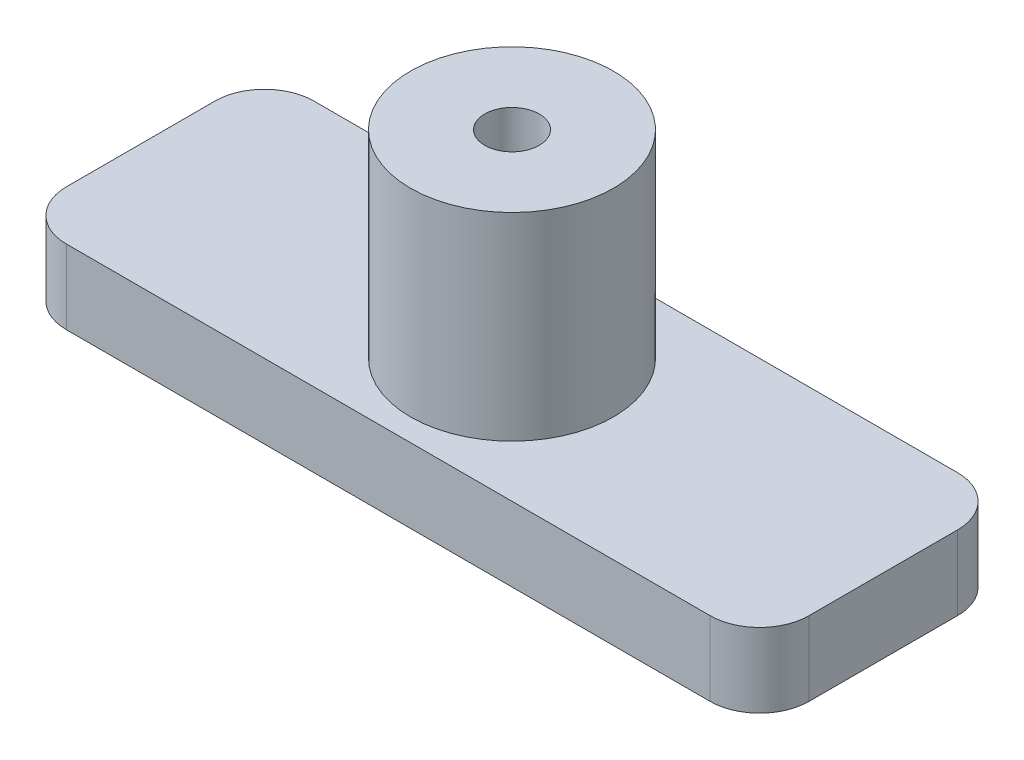
from build123d import *

# Parameters (mm, degrees)
SKETCH1_W           = 30
SKETCH1_H           = 10
BOSS_EXTRUDE1_DEPTH = 3
SKETCH2_R           = 4.1
SKETCH2_R_2         = 1.1
BOSS_EXTRUDE2_DEPTH = 8
FILLET1_R           = 2


with BuildPart() as part:
    # Sketch1 → Boss-Extrude1 (new body)
    with BuildSketch(Plane(origin=(0, 0, 0), x_dir=(1, 0, 0), z_dir=(0, 1, 0))):
        Rectangle(SKETCH1_W, SKETCH1_H)
    extrude(amount=BOSS_EXTRUDE1_DEPTH)

    # Sketch2 → Boss-Extrude2 (add)
    with BuildSketch(Plane(origin=(0, 3, 0), x_dir=(1, 0, 0), z_dir=(0, 1, 0))):
        Circle(SKETCH2_R)
        Circle(SKETCH2_R_2, mode=Mode.SUBTRACT)
    extrude(amount=BOSS_EXTRUDE2_DEPTH)

    # Fillet1
    fillet1_edges = [part.edges().sort_by_distance(p)[0] for p in [
        (15, 1.5, -5),
        (15, 1.5, 5),
        (-15, 1.5, -5),
        (-15, 1.5, 5),
    ]]
    fillet(fillet1_edges, radius=FILLET1_R)


solid = part.part
